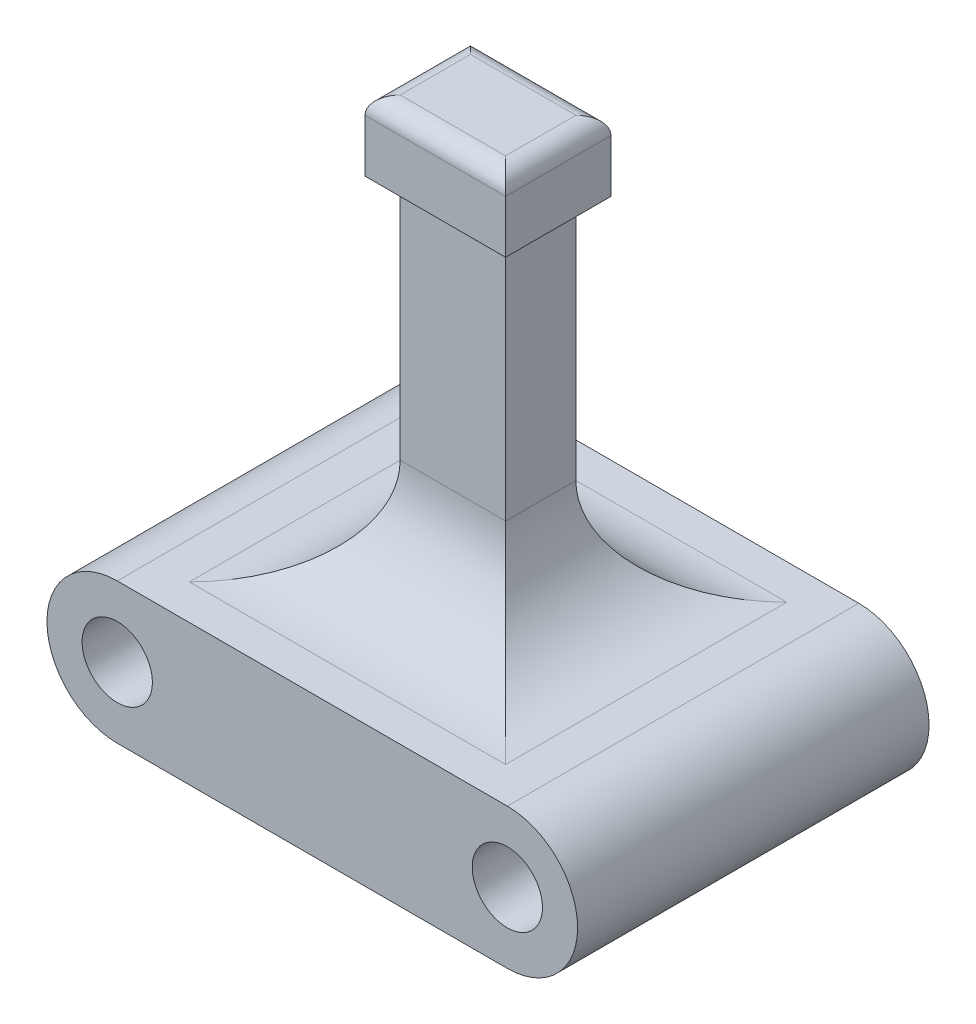
from build123d import *

# Parameters (mm, degrees)
SKETCH1_R           = 1
BOSS_EXTRUDE1_DEPTH = 10
SKETCH2_W           = 3
SKETCH2_H           = 2
BOSS_EXTRUDE2_DEPTH = 10
FILLET1_R           = 3
SKETCH3_W           = 4
SKETCH3_H           = 3
BOSS_EXTRUDE3_DEPTH = 2
FILLET2_R           = 0.5


with BuildPart() as part:
    # Sketch1 → Boss-Extrude1 (new body)
    with BuildSketch(Plane.XY):
        with BuildLine():
            Line((5.55, -2), (-5.55, -2))
            ThreePointArc((-5.55, -2), (-7.55, 0), (-5.55, 2))
            Line((-5.55, 2), (5.55, 2))
            ThreePointArc((5.55, 2), (7.55, 0), (5.55, -2))
        make_face()
        with Locations((-5.55, 0)):
            Circle(SKETCH1_R, mode=Mode.SUBTRACT)
        with Locations((5.55, 0)):
            Circle(SKETCH1_R, mode=Mode.SUBTRACT)
    extrude(amount=BOSS_EXTRUDE1_DEPTH)

    # Sketch2 → Boss-Extrude2 (add)
    with BuildSketch(Plane(origin=(0, 2, 0), x_dir=(1, 0, 0), z_dir=(0, 1, 0))):
        with Locations((0, -5)):
            Rectangle(SKETCH2_W, SKETCH2_H)
    extrude(amount=BOSS_EXTRUDE2_DEPTH)

    # Fillet1
    fillet1_edges = [part.edges().sort_by_distance(p)[0] for p in [
        (1.5, 2, 5),
        (0, 2, 4),
        (-1.5, 2, 5),
        (0, 2, 6),
    ]]
    fillet(fillet1_edges, radius=FILLET1_R)

    # Sketch3 → Boss-Extrude3 (add)
    with BuildSketch(Plane(origin=(0, 12, 0), x_dir=(1, 0, 0), z_dir=(0, 1, 0))):
        with Locations((0, -5)):
            Rectangle(SKETCH3_W, SKETCH3_H)
    extrude(amount=BOSS_EXTRUDE3_DEPTH)

    # Fillet2
    fillet2_edges = [part.edges().sort_by_distance(p)[0] for p in [
        (1.5, 12, 5),
        (0, 12, 4),
        (-1.5, 12, 5),
        (0, 12, 6),
        (-2, 14, 5),
        (0, 14, 6.5),
        (2, 14, 5),
        (0, 14, 3.5),
    ]]
    fillet(fillet2_edges, radius=FILLET2_R - 0.0001)  # a hair under: the kernel refuses the full size


solid = part.part
